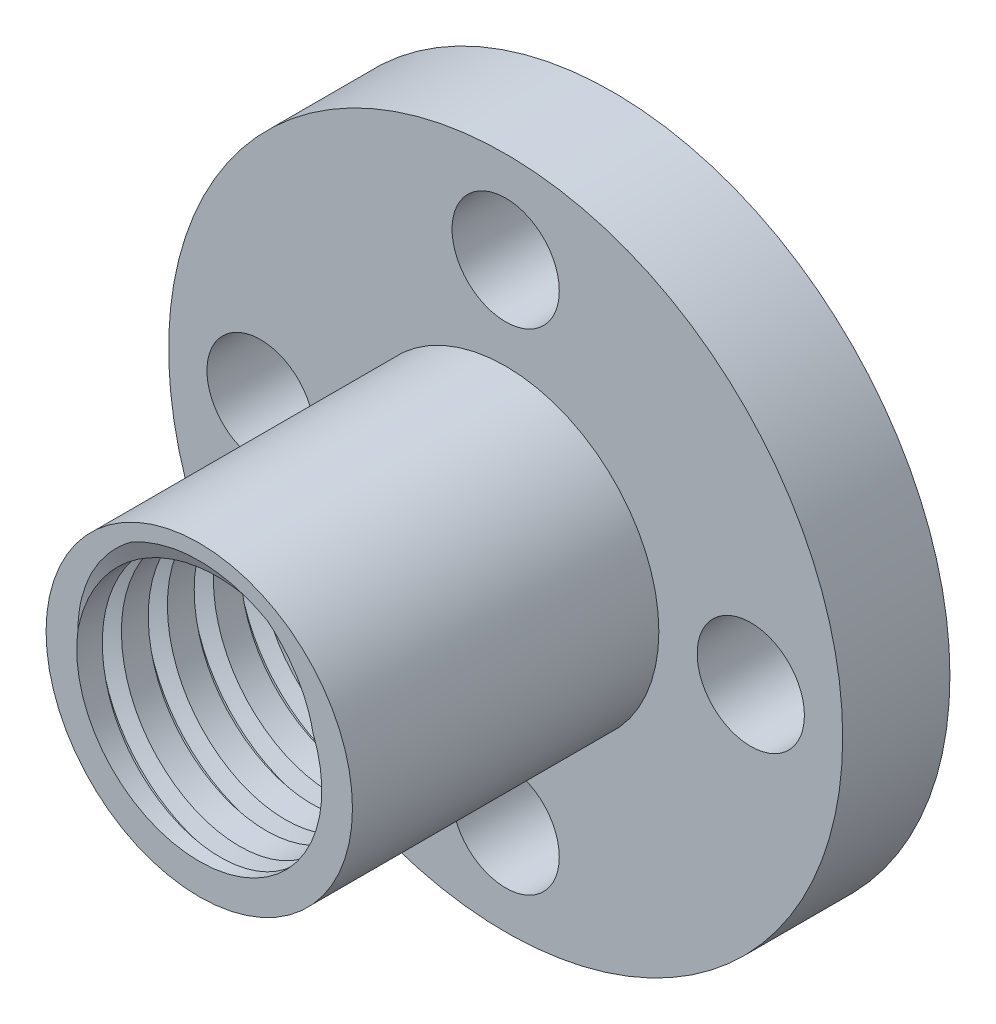
from build123d import *

# Parameters (mm, degrees)
SKETCH1_R           = 5
BOSS_EXTRUDE1_DEPTH = 1.5
SKETCH2_R           = 11
BOSS_EXTRUDE2_DEPTH = 3.5
SKETCH3_R           = 5
BOSS_EXTRUDE3_DEPTH = 10
SKETCH4_R           = 1.75
CUT_EXTRUDE1_DEPTH  = 4
SKETCH5_R           = 4
CUT_EXTRUDE2_DEPTH  = 15
CUT_SWEEP1_PITCH    = 1.5


with BuildPart() as part:
    # Sketch1 → Boss-Extrude1 (new body)
    with BuildSketch(Plane.XY):
        Circle(SKETCH1_R)
    extrude(amount=BOSS_EXTRUDE1_DEPTH)

    # Sketch2 → Boss-Extrude2 (add)
    with BuildSketch(Plane.XY.offset(1.5)):
        Circle(SKETCH2_R)
    extrude(amount=BOSS_EXTRUDE2_DEPTH)

    # Sketch3 → Boss-Extrude3 (add)
    with BuildSketch(Plane.XY.offset(5)):
        Circle(SKETCH3_R)
    extrude(amount=BOSS_EXTRUDE3_DEPTH)

    # Sketch4 → Cut-Extrude1 (cut)
    with BuildSketch(Plane.XY.offset(5)):
        with Locations((0, 8)):
            Circle(SKETCH4_R)
        with Locations((0, -8)):
            Circle(SKETCH4_R)
        with Locations((8, 0)):
            Circle(SKETCH4_R)
        with Locations((-8, 0)):
            Circle(SKETCH4_R)
    extrude(amount=-CUT_EXTRUDE1_DEPTH, mode=Mode.SUBTRACT)

    # Sketch5 → Cut-Extrude2 (cut)
    with BuildSketch(Plane.XY.offset(15)):
        Circle(SKETCH5_R)
    extrude(amount=-CUT_EXTRUDE2_DEPTH, mode=Mode.SUBTRACT)

    # Cut-Sweep1: arcs per turn and ends read off the stored shape
    # Cut-Sweep1: the profile of Sketch6 screwed along a right-hand helix through 11.25 turns, 8 arcs to a turn; built about Z, then put on its axis
    cut_sweep1_z = Axis((0, 0, 0), (0, 0, 1))
    cut_sweep1_corners = [(3.5, 0, -0.933119954), (3.5, 0, 0.066880046), (4.5, 0, -0.25), (4.5, 0, -0.5)]
    with BuildLine(mode=Mode.PRIVATE) as cut_sweep1_profile:
        Line(cut_sweep1_corners[0], cut_sweep1_corners[1])
        Line(cut_sweep1_corners[1], cut_sweep1_corners[2])
        Line(cut_sweep1_corners[2], cut_sweep1_corners[3])
        Line(cut_sweep1_corners[3], cut_sweep1_corners[0])
    cut_sweep1_cap = Face(cut_sweep1_profile.wire())
    cut_sweep1_turn_angles = [0, 22.5, 45, 67.5, 90, 112.5, 135, 157.5, 180, 202.5, 225, 247.5, 270, 292.5, 315, 337.5, 360]
    cut_sweep1_turn_weights = [1, 0.9238795325112867, 1, 0.9238795325112867, 1, 0.9238795325112867, 1, 0.9238795325112867, 1, 0.9238795325112867, 1, 0.9238795325112867, 1, 0.9238795325112867, 1, 0.9238795325112867, 1]
    cut_sweep1_turn_rails = [Edge.make_bspline([Vector(p[0], p[1], 0).rotate(cut_sweep1_z, cut_sweep1_turn_angles[k]) / cut_sweep1_turn_weights[k] + Vector(0, 0, p[2] + CUT_SWEEP1_PITCH * cut_sweep1_turn_angles[k] / 360) for k in range(17)], [0, 0, 0, 1, 1, 2, 2, 3, 3, 4, 4, 5, 5, 6, 6, 7, 7, 8, 8, 8], 2, cut_sweep1_turn_weights) for p in cut_sweep1_corners]
    cut_sweep1_turn_sides = [Face.make_surface_from_curves(cut_sweep1_turn_rails[p[0]], cut_sweep1_turn_rails[p[1]]) for p in [(0, 1), (1, 2), (2, 3), (3, 0)]]
    cut_sweep1_last_angles = [3960, 3982.5, 4005, 4027.5, 4050]
    cut_sweep1_last_weights = [1, 0.9238795325112867, 1, 0.9238795325112883, 1]
    cut_sweep1_last_rails = [Edge.make_bspline([Vector(p[0], p[1], 0).rotate(cut_sweep1_z, cut_sweep1_last_angles[k]) / cut_sweep1_last_weights[k] + Vector(0, 0, p[2] + CUT_SWEEP1_PITCH * cut_sweep1_last_angles[k] / 360) for k in range(5)], [0, 0, 0, 1, 1, 2, 2, 2], 2, cut_sweep1_last_weights) for p in cut_sweep1_corners]
    cut_sweep1_last_sides = [Face.make_surface_from_curves(cut_sweep1_last_rails[p[0]], cut_sweep1_last_rails[p[1]]) for p in [(0, 1), (1, 2), (2, 3), (3, 0)]]
    cut_sweep1 = Plane(origin=(0, 0, 0), x_dir=(1, 0, 0), z_dir=(0, 0, 1)) * Solid(Shell([*[p.moved(Location((0, 0, CUT_SWEEP1_PITCH * i))) for i in range(11) for p in cut_sweep1_turn_sides], *cut_sweep1_last_sides, cut_sweep1_cap, cut_sweep1_cap.rotate(cut_sweep1_z, 4050).moved(Location((0, 0, CUT_SWEEP1_PITCH * 4050 / 360)))]))
    add(cut_sweep1, mode=Mode.SUBTRACT)


solid = part.part
